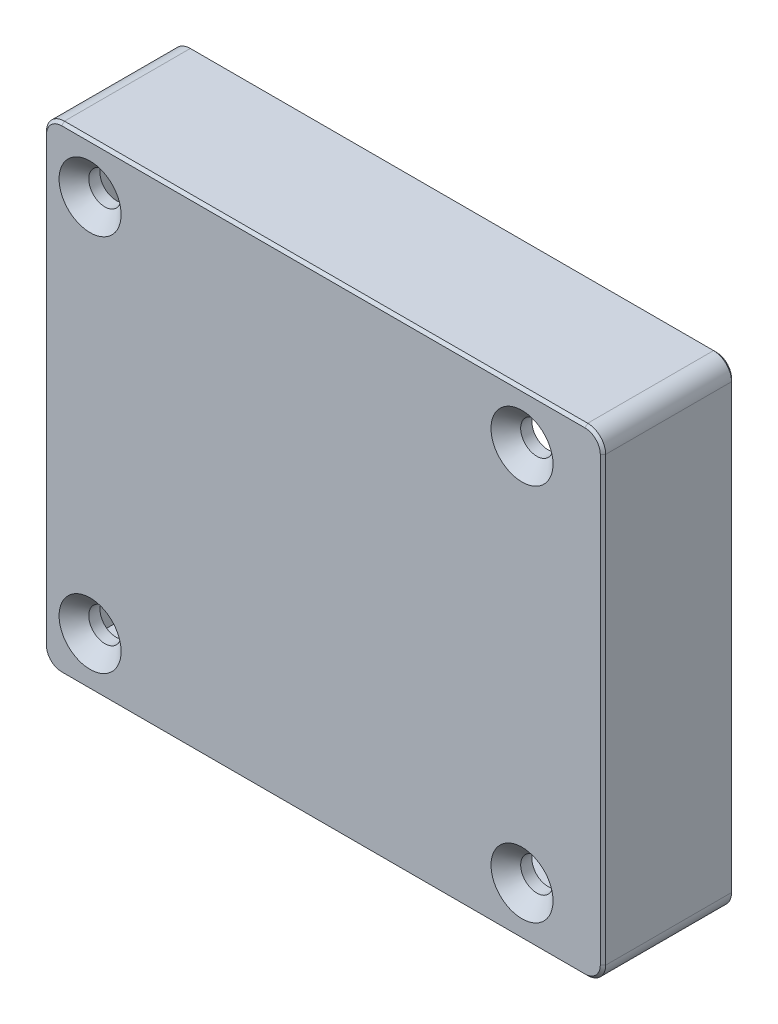
from build123d import *

# Parameters (mm, degrees)
SKIZZE1_W                                            = 62.2
SKIZZE1_H                                            = 53.2
SKIZZE1_W_2                                          = 58.5
SKIZZE1_H_2                                          = 49.5
AUFSATZ_LINEAR_AUSTRAGEN1_DEPTH                      = 13.2
SKIZZE2_W                                            = 62.2
SKIZZE2_H                                            = 53.2
AUFSATZ_LINEAR_AUSTRAGEN2_DEPTH                      = 1.4
SKIZZE3_W                                            = 12
SKIZZE3_H                                            = 10
AUFSATZ_LINEAR_AUSTRAGEN3_DEPTH                      = 1.5
SKIZZE4_R                                            = 1.65
SCHNITT_LINEAR_AUSTRAGEN1_DEPTH                      = 81.098907608
VERRUNDUNG1_R                                        = 2
FASE3_SIZE                                           = 0.3
FORMSENKUNG_F_R_M3_SENKSCHRAUBE_MIT_SCHL_D           = 3.6
FORMSENKUNG_F_R_M3_SENKSCHRAUBE_MIT_SCHL_CSINK_D     = 6.9
FORMSENKUNG_F_R_M3_SENKSCHRAUBE_MIT_SCHL_CSINK_ANGLE = 90


with BuildPart() as part:
    # Skizze1 → Aufsatz-Linear austragen1 (new body)
    with BuildSketch(Plane.XY):
        with Locations((29.25, 24.75)):
            Rectangle(SKIZZE1_W, SKIZZE1_H)
        with Locations((29.25, 24.75)):
            Rectangle(SKIZZE1_W_2, SKIZZE1_H_2, mode=Mode.SUBTRACT)
    extrude(amount=AUFSATZ_LINEAR_AUSTRAGEN1_DEPTH)

    # Skizze2 → Aufsatz-Linear austragen2 (add)
    with BuildSketch(Plane.XY.offset(13.2)):
        with Locations((29.25, 24.75)):
            Rectangle(SKIZZE2_W, SKIZZE2_H)
    extrude(amount=AUFSATZ_LINEAR_AUSTRAGEN2_DEPTH)

    # Skizze3 → Aufsatz-Linear austragen3 (add)
    with BuildSketch(Plane(origin=(0, 0, 13.2), x_dir=(-1, 0, 0), z_dir=(0, 0, -1))):
        with Locations((-52.5, 44.5)):
            Rectangle(SKIZZE3_W, SKIZZE3_H)
        with Locations((-6, 44.5)):
            Rectangle(SKIZZE3_W, SKIZZE3_H)
        with Locations((-6, 5)):
            Rectangle(SKIZZE3_W, SKIZZE3_H)
        with Locations((-52.5, 5)):
            Rectangle(SKIZZE3_W, SKIZZE3_H)
    extrude(amount=AUFSATZ_LINEAR_AUSTRAGEN3_DEPTH)

    # Skizze4 → Schnitt-Linear austragen1 (cut, through all)
    with BuildSketch(Plane(origin=(0, 0, 11.7), x_dir=(-1, 0, 0), z_dir=(0, 0, -1))):
        with Locations((-51.34447199, 45.785)):
            Circle(SKIZZE4_R)
        with Locations((-3.30447199, 45.785)):
            Circle(SKIZZE4_R)
        with Locations((-3.30447199, 3.715)):
            Circle(SKIZZE4_R)
        with Locations((-51.34447199, 3.715)):
            Circle(SKIZZE4_R)
    extrude(amount=-SCHNITT_LINEAR_AUSTRAGEN1_DEPTH, mode=Mode.SUBTRACT)

    # Verrundung1
    verrundung1_edges = [part.edges().sort_by_distance(p)[0] for p in [
        (60.35, 51.35, 7.3),
        (-1.85, 51.35, 7.3),
        (-1.85, -1.85, 7.3),
        (60.35, -1.85, 7.3),
    ]]
    fillet(verrundung1_edges, radius=VERRUNDUNG1_R)

    # Fase3
    fase3_edges = [part.edges().sort_by_distance(p)[0] for p in [
        (-1.85, 24.75, 0),
        (-1.264213562, -1.264213562, 0),
        (-1.264213562, 50.764213562, 0),
        (29.25, -1.85, 0),
        (29.25, 51.35, 0),
        (59.764213562, -1.264213562, 0),
        (59.764213562, 50.764213562, 0),
        (60.35, 24.75, 0),
        (-1.85, 24.75, 14.6),
        (-1.264213562, -1.264213562, 14.6),
        (-1.264213562, 50.764213562, 14.6),
        (29.25, -1.85, 14.6),
        (29.25, 51.35, 14.6),
        (59.764213562, -1.264213562, 14.6),
        (59.764213562, 50.764213562, 14.6),
        (60.35, 24.75, 14.6),
    ]]
    chamfer(fase3_edges, length=FASE3_SIZE)

    # Formsenkung für M3 Senkschraube mit Schlitz/Kreuzschlitz2 (through all)
    with Locations(Plane.XY.offset(14.6)):
        with Locations((3.30447199, 3.715), (3.30447199, 45.785), (51.34447199, 45.785), (51.34447199, 3.715)):
            CounterSinkHole(FORMSENKUNG_F_R_M3_SENKSCHRAUBE_MIT_SCHL_D / 2, FORMSENKUNG_F_R_M3_SENKSCHRAUBE_MIT_SCHL_CSINK_D / 2, counter_sink_angle=FORMSENKUNG_F_R_M3_SENKSCHRAUBE_MIT_SCHL_CSINK_ANGLE)


solid = part.part
